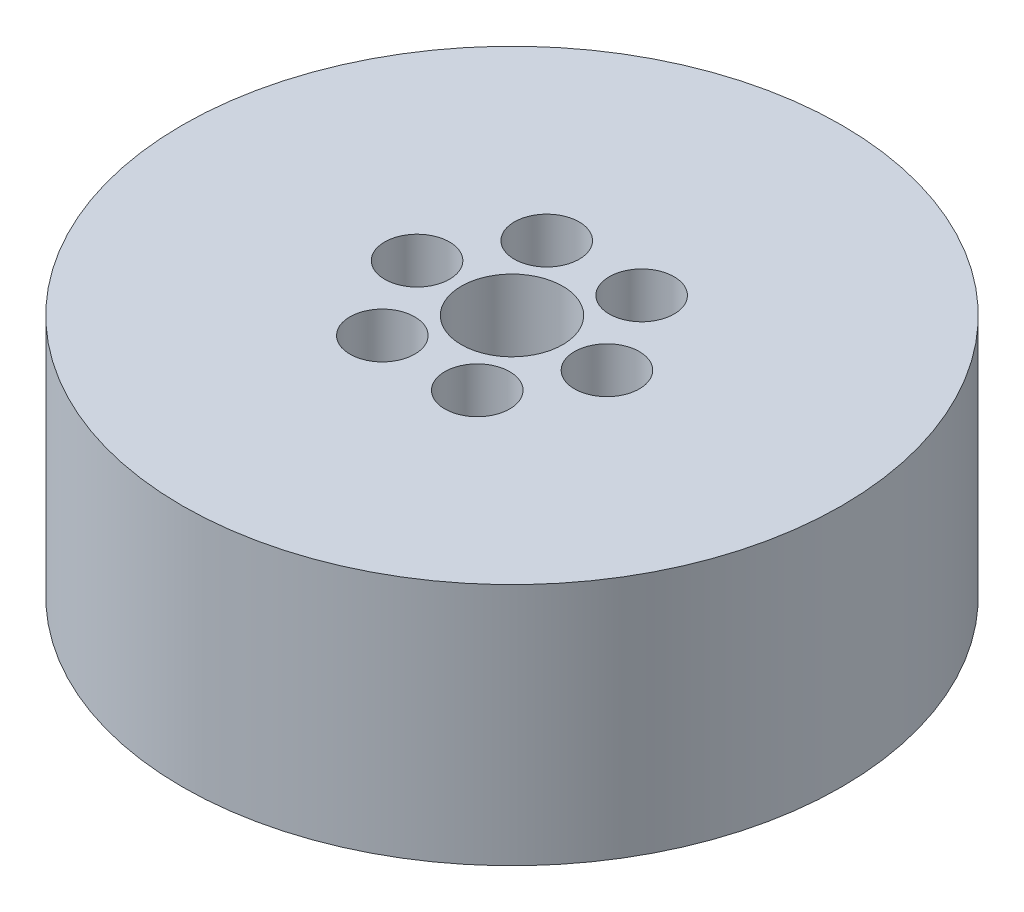
from build123d import *

# Parameters (mm, degrees)
SKETCH1_R           = 32.5
BOSS_EXTRUDE1_DEPTH = 24
SKETCH2_R           = 5
CUT_EXTRUDE1_DEPTH  = 52.850747343
SKETCH3_R           = 3.193957473
CUT_EXTRUDE2_DEPTH  = 18.823750096
CIRPATTERN1_COUNT   = 6


with BuildPart() as part:
    # Sketch1 → Boss-Extrude1 (new body)
    with BuildSketch(Plane(origin=(0, 0, 0), x_dir=(1, 0, 0), z_dir=(0, 1, 0))):
        Circle(SKETCH1_R)
    extrude(amount=BOSS_EXTRUDE1_DEPTH)

    # Sketch2 → Cut-Extrude1 (cut, through all)
    with BuildSketch(Plane(origin=(0, 0, 0), x_dir=(1, 0, 0), z_dir=(0, 1, 0))):
        Circle(SKETCH2_R)
    extrude(amount=CUT_EXTRUDE1_DEPTH, mode=Mode.SUBTRACT)

    # Sketch3 → Cut-Extrude2 (cut)
    with BuildSketch(Plane(origin=(0, 24, 0), x_dir=(1, 0, 0), z_dir=(0, 1, 0))):
        with Locations((-9.356961517, 0)):
            Circle(SKETCH3_R)
    cut_extrude2 = extrude(amount=-CUT_EXTRUDE2_DEPTH, mode=Mode.SUBTRACT)

    # CirPattern1: Cut-Extrude2 ×6 about axis
    cirpattern1_axis = Axis((0, 0, 0), (0, 1, 0))
    for i in range(1, CIRPATTERN1_COUNT):
        add(cut_extrude2.rotate(cirpattern1_axis, i * 360 / CIRPATTERN1_COUNT), mode=Mode.SUBTRACT)


solid = part.part
